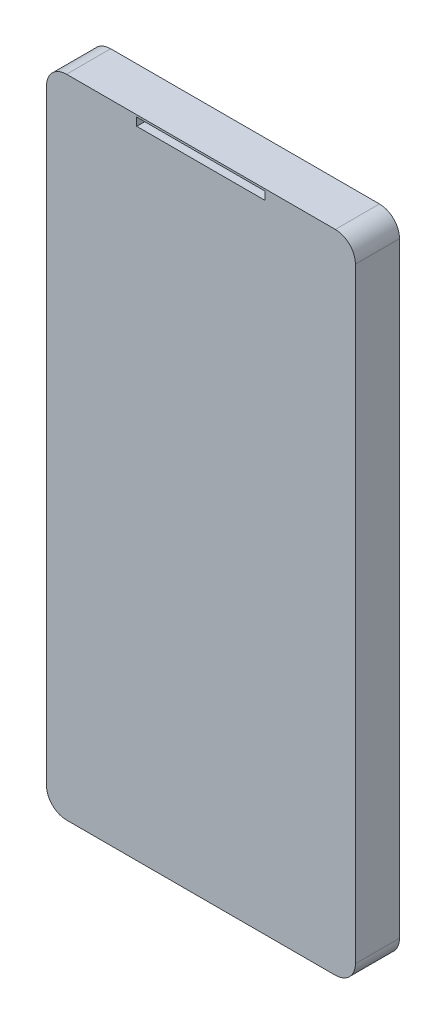
from build123d import *

# Parameters (mm, degrees)
SKETCH_1_W          = 77
SKETCH_1_H          = 161
EXTRUDE_1_DEPTH     = 11
SKETCH_2_W          = 33
SKETCH_2_H          = 63
EXTRUDE_2_DEPTH     = 2.1
FILLET_1_R          = 5
FILLET_2_R          = 5
SKETCH_3_W          = 32
SKETCH_3_H          = 2
CUT_EXTRUDE_1_DEPTH = 2
WRAP_1_OUTLINE_R    = 1
WRAP_1_DEPTH        = 0.01


# Read off the part's stored shape, not the designer's step: 包覆1
with BuildPart() as part:
    # 草图1 → 凸台-拉伸1 (new body)
    with BuildSketch(Plane.XY):
        Rectangle(SKETCH_1_W, SKETCH_1_H)
    extrude(amount=EXTRUDE_1_DEPTH)

    # 草图2 → 凸台-拉伸2 (add)
    with BuildSketch(Plane(origin=(0, 0, 0), x_dir=(-1, 0, 0), z_dir=(0, 0, -1))):
        with Locations((-15, 45)):
            Rectangle(SKETCH_2_W, SKETCH_2_H)
    extrude(amount=EXTRUDE_2_DEPTH)

    # 圆角1
    fillet_1_edges = [part.edges().sort_by_distance(p)[0] for p in [
        (31.5, 76.5, -1.05),
        (31.5, 13.5, -1.05),
        (-1.5, 13.5, -1.05),
        (-1.5, 76.5, -1.05),
    ]]
    fillet(fillet_1_edges, radius=FILLET_1_R)

    # 圆角2
    fillet_2_edges = [part.edges().sort_by_distance(p)[0] for p in [
        (38.5, -80.5, 5.5),
        (-38.5, -80.5, 5.5),
        (-38.5, 80.5, 5.5),
        (38.5, 80.5, 5.5),
    ]]
    fillet(fillet_2_edges, radius=FILLET_2_R)

    # 草图3 → 切除-拉伸1 (cut)
    with BuildSketch(Plane.XY.offset(11)):
        with Locations((0, 79)):
            Rectangle(SKETCH_3_W, SKETCH_3_H)
    extrude(amount=-CUT_EXTRUDE_1_DEPTH, mode=Mode.SUBTRACT)

    # 包覆1 outline → 包覆1 (add)
    with BuildSketch(Plane(origin=(0, 0, 0), x_dir=(-1, 0, 0), z_dir=(0, 0, -1))):
        Circle(WRAP_1_OUTLINE_R)
    extrude(amount=WRAP_1_DEPTH)


solid = part.part
